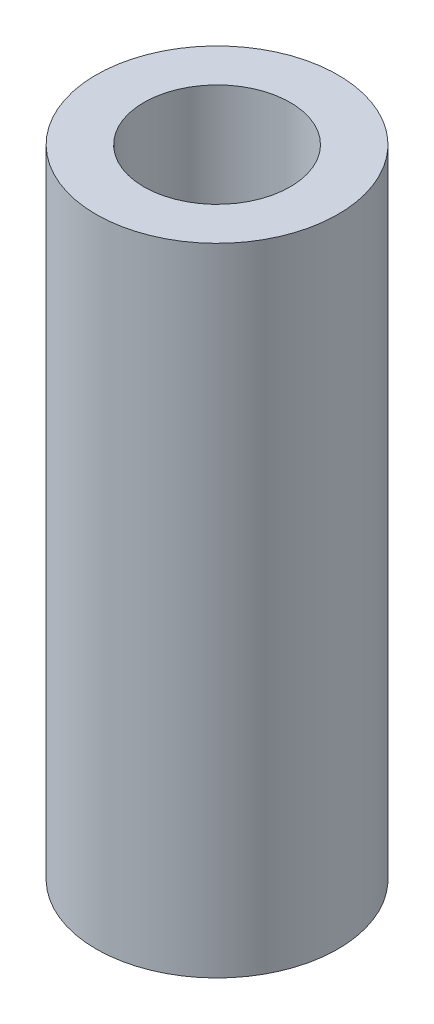
from build123d import *

# Parameters (mm, degrees)
SKETCH1_R           = 3.8
SKETCH1_R_2         = 2.3
BOSS_EXTRUDE1_DEPTH = 20


with BuildPart() as part:
    # Sketch1 → Boss-Extrude1 (new body)
    with BuildSketch(Plane(origin=(0, 0, 0), x_dir=(1, 0, 0), z_dir=(0, 1, 0))):
        Circle(SKETCH1_R)
        Circle(SKETCH1_R_2, mode=Mode.SUBTRACT)
    extrude(amount=BOSS_EXTRUDE1_DEPTH)


solid = part.part
